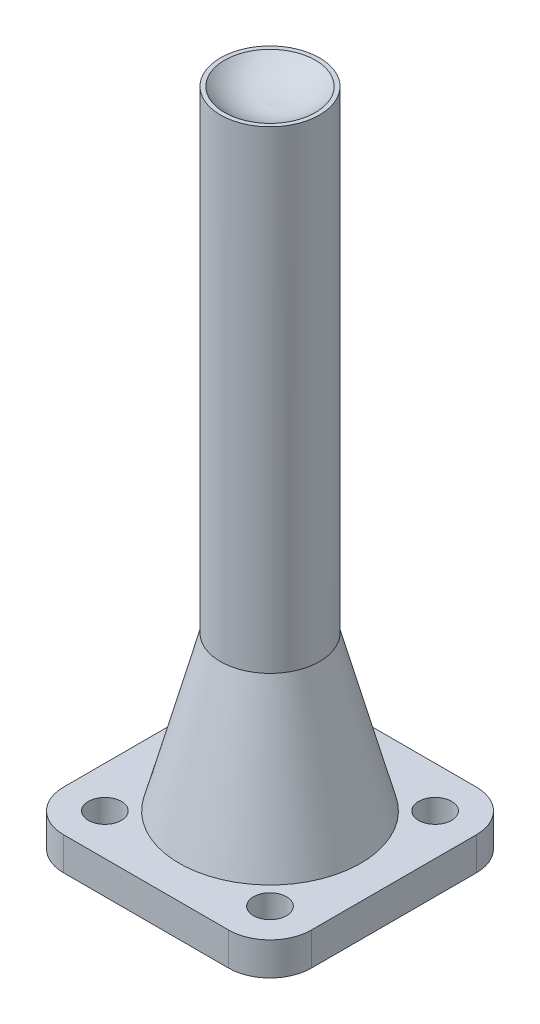
from build123d import *

# Parameters (mm, degrees)
SKETCH_1_W      = 30
SKETCH_1_H      = 30
SKETCH_1_R      = 2
EXTRUDE_1_DEPTH = 4
FILLET_1_R      = 5
SKETCH_2_R      = 6
EXTRUDE_2_DEPTH = 76
CHAMFER_1_SIZE  = 5
CHAMFER_1_SIZE2 = 18.660254038


with BuildPart() as part:
    # Эскиз1 → Бобышка-Вытянуть1 (new body)
    with BuildSketch(Plane(origin=(0, 0, 0), x_dir=(1, 0, 0), z_dir=(0, 1, 0))):
        Rectangle(SKETCH_1_W, SKETCH_1_H)
        with Locations((-10, 10)):
            Circle(SKETCH_1_R, mode=Mode.SUBTRACT)
        with Locations((10, 10)):
            Circle(SKETCH_1_R, mode=Mode.SUBTRACT)
        with Locations((10, -10)):
            Circle(SKETCH_1_R, mode=Mode.SUBTRACT)
        with Locations((-10, -10)):
            Circle(SKETCH_1_R, mode=Mode.SUBTRACT)
    extrude(amount=EXTRUDE_1_DEPTH)

    # Скругление1
    fillet_1_edges = [part.edges().sort_by_distance(p)[0] for p in [
        (15, 2, 15),
        (-15, 2, -15),
        (15, 2, -15),
        (-15, 2, 15),
    ]]
    fillet(fillet_1_edges, radius=FILLET_1_R)

    # Эскиз2 → Бобышка-Вытянуть2 (add)
    with BuildSketch(Plane(origin=(0, 4, 0), x_dir=(1, 0, 0), z_dir=(0, 1, 0))):
        Circle(SKETCH_2_R)
    extrude(amount=EXTRUDE_2_DEPTH)

    # Эскиз7 → Вырез-Повернуть3 (revolve, cut)
    with BuildSketch(Plane.XY):
        with BuildLine():
            Line((5.5, 80), (0, 80))
            Line((0, 80), (0, 78))
            ThreePointArc((0, 78), (2.979435889, 78.369051304), (5.5, 80))
        make_face()
    revolve(axis=Axis((0, 82.404747685, 0), (0, -1, 0)), mode=Mode.SUBTRACT)

    # Фаска1
    chamfer_1_edges = [part.edges().sort_by_distance(p)[0] for p in [
        (-6, 4, 0),
    ]]
    chamfer_1_side = [part.faces().sort_by_distance(p)[0] for p in [
        (0, 4, 14.575735931),
    ]]
    chamfer(chamfer_1_edges, length=CHAMFER_1_SIZE, length2=CHAMFER_1_SIZE2, reference=chamfer_1_side[0])


solid = part.part
